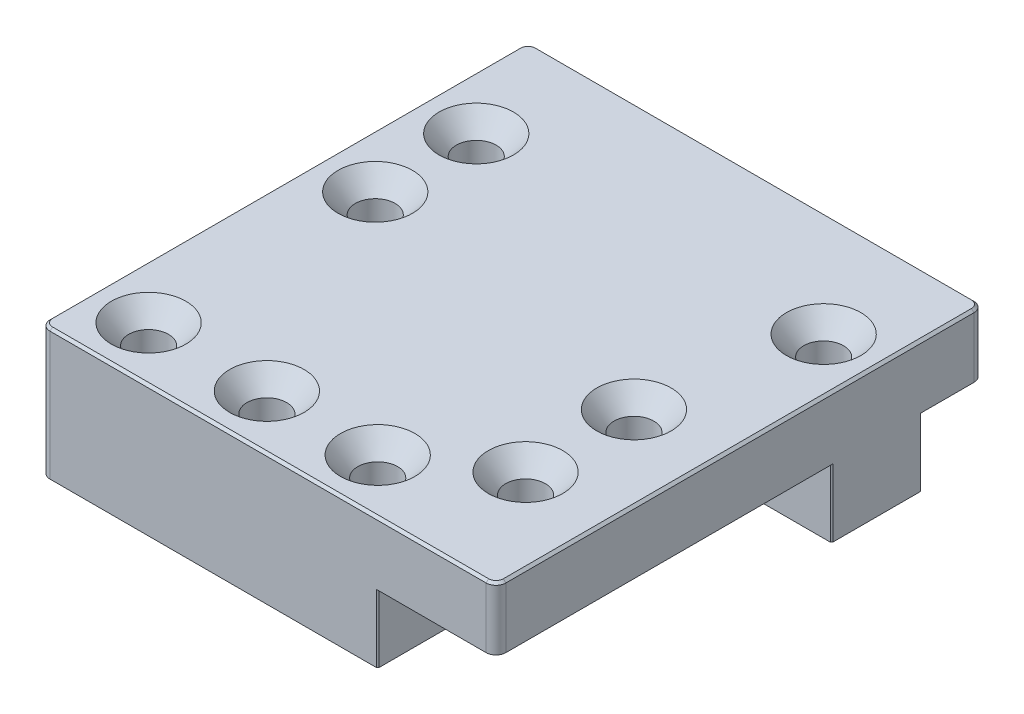
from build123d import *

# Parameters (mm, degrees)
SKETCH1_W                           = 18.5
SKETCH1_H                           = 19.8
BE_00_BODY_DEPTH                    = 5.3
CE_00_MAIN_CAVITY_DEPTH             = 0.7112
CUT_EXTRUDE26_DEPTH                 = 1.5
CE_00_OUTPUT_CAVITY_DEPTH           = 2.75
CE_00_MULTIPIN_CAVITY_DEPTH         = 3.66
SKETCH43_W                          = 24.756879044
SKETCH43_H                          = 5.996687822
CE_00_NEAR_MULTIPIN_CONNECTOR_DEPTH = 2.75
CE_00_DC_BOARD_CAVITY_DEPTH         = 2
FILLET_A_0_4MM_R                    = 0.4
FILLET_B_0_2_R                      = 0.2
FILLET_C_0_16MM_R                   = 0.16
FILLET_E_0_05MM_R                   = 0.05
CHAMFER_A_0_10MM_SIZE               = 0.1
CHAMFER1_SIZE                       = 0.0508


# Read off the part's stored shape, not the designer's step: CSK for #0 Flat Head Machine Screw2
with BuildPart() as part:
    # Sketch1 → BE-00 Body (new body)
    with BuildSketch(Plane(origin=(0, 0, 0), x_dir=(1, 0, 0), z_dir=(0, 1, 0))):
        with Locations((0.75, 3.1)):
            Rectangle(SKETCH1_W, SKETCH1_H)
    extrude(amount=BE_00_BODY_DEPTH)

    # Sketch9 → CE-00 Main Cavity (cut)
    with BuildSketch(Plane(origin=(0, 0, 0), x_dir=(1, 0, 0), z_dir=(0, 1, 0))):
        with BuildLine():
            Line((2.146781775, -1.5534), (12.535922666, -1.5534))
            Line((12.535922666, -1.5534), (12.535922666, 2.0534))
            Line((12.535922666, 2.0534), (2.2, 2.0534))
            Line((2.2, 2.0534), (2.2, 6.384290248))
            Line((2.2, 6.384290248), (0, 6.384290248))
            Line((0, 6.384290248), (0, 2.4))
            Line((0, 2.4), (-10.40064316, 2.4))
            Line((-10.40064316, 2.4), (-10.40064316, -2.4))
            Line((-10.40064316, -2.4), (1, -2.4))
            ThreePointArc((1, -2.4), (1.712713126, -2.165422187), (2.146781775, -1.5534))
        make_face()
    extrude(amount=CE_00_MAIN_CAVITY_DEPTH, mode=Mode.SUBTRACT)

    # Sketch45 → Cut-Extrude26 (cut)
    with BuildSketch(Plane(origin=(0, 0, 0), x_dir=(1, 0, 0), z_dir=(0, 1, 0))):
        with BuildLine():
            Line((-0.5, -2.4), (-10.40064316, -2.4))
            Line((-10.40064316, -2.4), (-10.40064316, 2.4))
            Line((-10.40064316, 2.4), (-0.5, 2.4))
            ThreePointArc((-0.5, 2.4), (-0.075735931, 2.224264069), (0.1, 1.8))
            Line((0.1, 1.8), (0.1, -1.8))
            ThreePointArc((0.1, -1.8), (-0.075735931, -2.224264069), (-0.5, -2.4))
        make_face()
        with BuildLine():
            Line((12.535922666, -1.5534), (2.8, -1.5534))
            ThreePointArc((2.8, -1.5534), (2.375735931, -1.377664069), (2.2, -0.9534))
            Line((2.2, -0.9534), (2.2, 1.4534))
            ThreePointArc((2.2, 1.4534), (2.375735931, 1.877664069), (2.8, 2.0534))
            Line((2.8, 2.0534), (12.535922666, 2.0534))
            Line((12.535922666, 2.0534), (12.535922666, -1.5534))
        make_face()
    extrude(amount=CUT_EXTRUDE26_DEPTH, mode=Mode.SUBTRACT)

    # Sketch29 → CE-00 Output Cavity (cut)
    with BuildSketch(Plane.XZ):
        with BuildLine():
            Line((5.1994, -5.22), (5.1994, 10.160265554))
            Line((5.1994, 10.160265554), (12.409807772, 10.160265554))
            Line((12.409807772, 10.160265554), (12.409807772, -6.82))
            Line((12.409807772, -6.82), (6.7994, -6.82))
            ThreePointArc((6.7994, -6.82), (5.66802915, -6.35137085), (5.1994, -5.22))
        make_face()
    extrude(amount=-CE_00_OUTPUT_CAVITY_DEPTH, mode=Mode.SUBTRACT)

    # Sketch4 → CE-00 Multipin Cavity (cut)
    with BuildSketch(Plane(origin=(0, 0, 0), x_dir=(1, 0, 0), z_dir=(0, 1, 0))):
        with BuildLine():
            Line((-1.393549192, 5.214359354), (-3.1256, 6.214359354))
            ThreePointArc((-3.1256, 6.214359354), (-3.711240646, 6.8), (-3.9256, 7.6))
            Line((-3.9256, 7.6), (-3.9256, 16))
            Line((-3.9256, 16), (5.6756, 16))
            Line((5.6756, 16), (5.6756, 7.6))
            ThreePointArc((5.6756, 7.6), (5.461240646, 6.8), (4.8756, 6.214359354))
            Line((4.8756, 6.214359354), (3.143549192, 5.214359354))
            ThreePointArc((3.143549192, 5.214359354), (2.757659665, 5.054518678), (2.343549192, 5))
            Line((2.343549192, 5), (-0.593549192, 5))
            ThreePointArc((-0.593549192, 5), (-1.007659665, 5.054518678), (-1.393549192, 5.214359354))
        make_face()
    extrude(amount=CE_00_MULTIPIN_CAVITY_DEPTH, mode=Mode.SUBTRACT)

    # Sketch43 → CE-00 Near Multipin Connector (cut)
    with BuildSketch(Plane(origin=(0, 0, 0), x_dir=(1, 0, 0), z_dir=(0, 1, 0))):
        with Locations((0.495115422, 13.478343911)):
            Rectangle(SKETCH43_W, SKETCH43_H)
    extrude(amount=CE_00_NEAR_MULTIPIN_CONNECTOR_DEPTH, mode=Mode.SUBTRACT)

    # Sketch10 → CE-00 DC board Cavity (cut)
    with BuildSketch(Plane(origin=(0, 0, 0), x_dir=(1, 0, 0), z_dir=(0, 1, 0))):
        with BuildLine():
            Line((5.6756, 6.82), (5.6756, 7.6))
            Line((5.6756, 7.6), (-4.0752, 7.6))
            ThreePointArc((-4.0752, 7.6), (-4.499464069, 7.424264069), (-4.6752, 7))
            Line((-4.6752, 7), (-4.6752, 3.4))
            ThreePointArc((-4.6752, 3.4), (-4.499464069, 2.975735931), (-4.0752, 2.8))
            Line((-4.0752, 2.8), (8.306329243, 2.8))
            Line((8.306329243, 2.8), (8.306329243, 6.82))
            Line((8.306329243, 6.82), (5.6756, 6.82))
        make_face()
    extrude(amount=CE_00_DC_BOARD_CAVITY_DEPTH, mode=Mode.SUBTRACT)

    # CSK for #0 Flat Head Machine Screw2 outl → CSK for #0 Flat Head Machine Screw2 (revolve, cut)
    with BuildSketch(Plane(origin=(3, 0, 4.6), x_dir=(1, 0, 0), z_dir=(0, 0, 1))):
        Polygon((0, 0), (1.000000032, 0), (0.80645, 0.193550032), (0.80645, 4.489162828), (1.5113, 5.3), (0, 5.3), align=None)
    revolve(axis=Axis((3, 0, 4.6), (0, 1, 0)), mode=Mode.SUBTRACT)

    # CSK for _0 Flat Head Machine Screw2 2 ou → CSK for _0 Flat Head Machine Screw2 2 (revolve, cut)
    with BuildSketch(Plane(origin=(-1.5, 0, 4.6), x_dir=(1, 0, 0), z_dir=(0, 0, 1))):
        Polygon((0, 0), (1.000000032, 0), (0.80645, 0.193550032), (0.80645, 4.489162828), (1.5113, 5.3), (0, 5.3), align=None)
    revolve(axis=Axis((-1.5, 0, 4.6), (0, 1, 0)), mode=Mode.SUBTRACT)

    # CSK for _0 Flat Head Machine Screw2 3 ou → CSK for _0 Flat Head Machine Screw2 3 (revolve, cut)
    with BuildSketch(Plane(origin=(-6.3, 0, 4.6), x_dir=(1, 0, 0), z_dir=(0, 0, 1))):
        Polygon((0, 0), (1.000000032, 0), (0.80645, 0.193550032), (0.80645, 4.489162828), (1.5113, 5.3), (0, 5.3), align=None)
    revolve(axis=Axis((-6.3, 0, 4.6), (0, 1, 0)), mode=Mode.SUBTRACT)

    # CSK for _0 Flat Head Machine Screw2 4 ou → CSK for _0 Flat Head Machine Screw2 4 (revolve, cut)
    with BuildSketch(Plane(origin=(6.6, 0, 2.2), x_dir=(1, 0, 0), z_dir=(0, 0, 1))):
        Polygon((0, 2.75), (1.000000032, 2.75), (0.80645, 2.943550032), (0.80645, 4.489162828), (1.5113, 5.3), (0, 5.3), align=None)
    revolve(axis=Axis((6.6, 0, 2.2), (0, 1, 0)), mode=Mode.SUBTRACT)

    # CSK for _0 Flat Head Machine Screw2 5 ou → CSK for _0 Flat Head Machine Screw2 5 (revolve, cut)
    with BuildSketch(Plane(origin=(6.6, 0, -2.2), x_dir=(1, 0, 0), z_dir=(0, 0, 1))):
        Polygon((0, 2.75), (1.000000032, 2.75), (0.80645, 2.943550032), (0.80645, 4.489162828), (1.5113, 5.3), (0, 5.3), align=None)
    revolve(axis=Axis((6.6, 0, -2.2), (0, 1, 0)), mode=Mode.SUBTRACT)

    # CSK for _0 Flat Head Machine Screw2 6 ou → CSK for _0 Flat Head Machine Screw2 6 (revolve, cut)
    with BuildSketch(Plane(origin=(-6.3, 0, -4.6), x_dir=(1, 0, 0), z_dir=(0, 0, 1))):
        Polygon((0, 0), (1.000000032, 0), (0.80645, 0.193550032), (0.80645, 4.489162828), (1.5113, 5.3), (0, 5.3), align=None)
    revolve(axis=Axis((-6.3, 0, -4.6), (0, 1, 0)), mode=Mode.SUBTRACT)

    # CSK for _0 Flat Head Machine Screw2 7 ou → CSK for _0 Flat Head Machine Screw2 7 (revolve, cut)
    with BuildSketch(Plane(origin=(-6.3, 0, -8.7), x_dir=(1, 0, 0), z_dir=(0, 0, 1))):
        Polygon((0, 0), (1.000000032, 0), (0.80645, 0.193550032), (0.80645, 4.489162828), (1.5113, 5.3), (0, 5.3), align=None)
    revolve(axis=Axis((-6.3, 0, -8.7), (0, 1, 0)), mode=Mode.SUBTRACT)

    # CSK for _0 Flat Head Machine Screw2 8 ou → CSK for _0 Flat Head Machine Screw2 8 (revolve, cut)
    with BuildSketch(Plane(origin=(7.8, 0, -8.7), x_dir=(1, 0, 0), z_dir=(0, 0, 1))):
        Polygon((0, 0), (1.000000032, 0), (0.80645, 0.193550032), (0.80645, 4.489162828), (1.5113, 5.3), (0, 5.3), align=None)
    revolve(axis=Axis((7.8, 0, -8.7), (0, 1, 0)), mode=Mode.SUBTRACT)

    # Fillet A 0.4mm
    fillet_a_0_4mm_edges = [part.edges().sort_by_distance(p)[0] for p in [
        (10, 4.025, 6.8),
        (-8.5, 2.65, 6.8),
        (-8.5, 4.025, -13),
        (10, 4.025, -13),
    ]]
    fillet(fillet_a_0_4mm_edges, radius=FILLET_A_0_4MM_R)

    # Fillet B 0.2
    # the kernel refuses this fillet: 0.2 mm, written as the material it takes off along each edge
    with BuildSketch(Plane(origin=(5.6756, -0.5, -6.82), x_dir=(0, 0, -1), z_dir=(0, 1, 0))) as fillet_b_0_2_piece_1:
        with BuildLine():
            CenterArc((FILLET_B_0_2_R, -FILLET_B_0_2_R), FILLET_B_0_2_R, 90, 90)
            Line((0, -FILLET_B_0_2_R), (0, 0))
            Line((0, 0), (FILLET_B_0_2_R, 0))
        make_face()
    extrude(amount=2.5, mode=Mode.SUBTRACT)
    with BuildSketch(Plane(origin=(5.6756, -0.5, -10.48), x_dir=(0, 0, 1), z_dir=(0, 1, 0)), Plane(origin=(-3.9256, 2.75, -10.48), x_dir=(0, 0, 1), z_dir=(0, -1, 0))) as fillet_b_0_2_piece_2:
        with BuildLine():
            CenterArc((FILLET_B_0_2_R, FILLET_B_0_2_R), FILLET_B_0_2_R, 180, 90)
            Line((0, FILLET_B_0_2_R), (0, 0))
            Line((0, 0), (FILLET_B_0_2_R, 0))
        make_face()
    extrude(amount=3.25, mode=Mode.SUBTRACT)
    with BuildSketch(Plane(origin=(-3.9256, -0.496027054, -7.6), x_dir=(0, 0, -1), z_dir=(0, 1, 0))) as fillet_b_0_2_piece_3:
        with BuildLine():
            CenterArc((0.198410822, 0.2), FILLET_B_0_2_R, 183.612026157, 86.387973843)
            Line((-0.001191884, 0.1874), (-0.021152154, 0.18614))
            ThreePointArc((-0.021152154, 0.18614), (-0.02, 0.1496), (-0.02, 0))
            Line((-0.02, 0), (0, -0.02))
            Line((0, -0.02), (0.198410822, -0.02))
            Line((0.198410822, -0.02), (0.198410822, 0))
        make_face()
    extrude(amount=2.496027054, mode=Mode.SUBTRACT)

    # Fillet C 0.16mm
    fillet_c_0_16mm_edges = [part.edges().sort_by_distance(p)[0] for p in [
        (2.2, 0.3556, -2.8),
        (0, 0.3556, -2.8),
        (0, 0.3556, -2.4),
        (2.146781775, 0.3556, 1.5534),
        (2.2, 0.3556, -2.0534),
    ]]
    fillet(fillet_c_0_16mm_edges, radius=FILLET_C_0_16MM_R)

    # Fillet E 0.05mm
    fillet_e_0_05mm_edges = [part.edges().sort_by_distance(p)[0] for p in [
        (5.1994, 0.75, 1.5534),
        (5.1994, 0.75, -2.0534),
        (5.1994, 1, -2.8),
    ]]
    fillet(fillet_e_0_05mm_edges, radius=FILLET_E_0_05MM_R)

    # Chamfer A 0.10mm
    chamfer_a_0_10mm_edges = [part.edges().sort_by_distance(p)[0] for p in [
        (-8.5, 5.3, -3.1),
        (0.75, 5.3, -13),
        (10, 5.3, -3.1),
        (0.75, 5.3, 6.8),
        (-8.382842712, 5.3, 6.682842712),
        (9.882842712, 5.3, 6.682842712),
        (9.882842712, 5.3, -12.882842712),
        (-8.382842712, 5.3, -12.882842712),
    ]]
    chamfer(chamfer_a_0_10mm_edges, length=CHAMFER_A_0_10MM_SIZE)

    # Chamfer1
    chamfer1_edges = [part.edges().sort_by_distance(p)[0] for p in [
        (10, 1.375, -6.82),
        (5.1994, 1.375, 6.8),
        (5.6756, 3.205, -13),
        (-3.9256, 3.205, -13),
        (10, 1.375, -10.48),
        (-8.5, 1.375, -10.48),
        (-8.5, 0.75, -2.4),
        (-8.5, 0.75, 2.4),
    ]]
    chamfer(chamfer1_edges, length=CHAMFER1_SIZE)


solid = part.part
